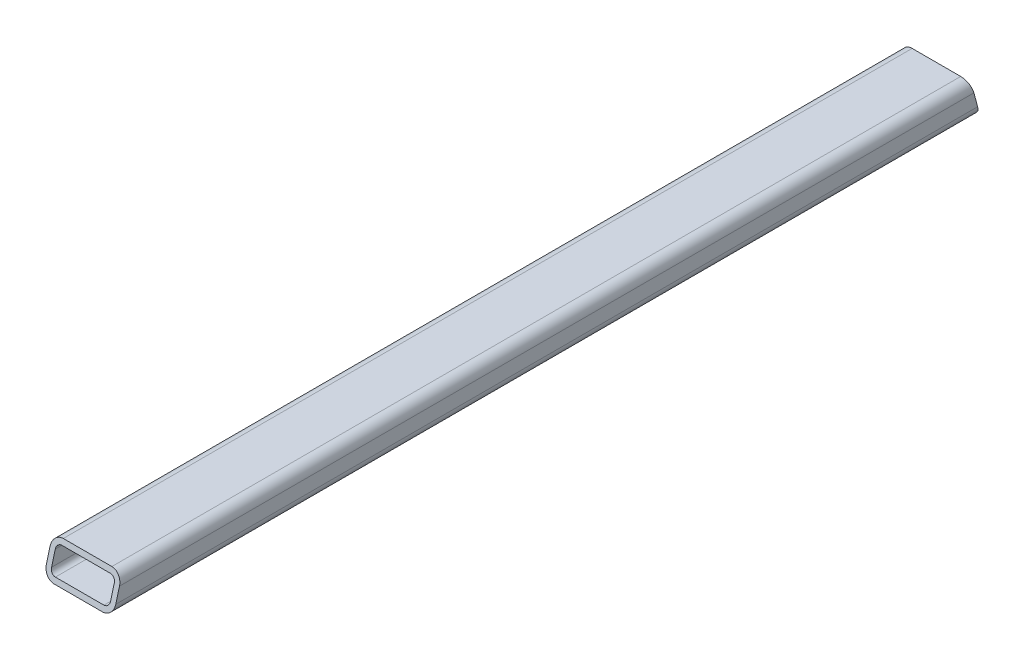
from build123d import *

# Parameters (mm, degrees)
EXTRUDE_1_DEPTH      = 250
EXTRUDE_1_DEPTH_BACK = 250
SHELL_1_T            = -3
CHAMFER_1_SIZE       = 5.358983849
CHAMFER_1_SIZE_2     = 20


with BuildPart() as part:
    # Эскиз1 → Бобышка-Вытянуть1 (new, two sides: drawn at the far end of the back side and taken through both)
    with BuildSketch(Plane.XY.offset(-EXTRUDE_1_DEPTH_BACK)):
        with BuildLine():
            Line((-14, 10), (14, 10))
            ThreePointArc((14, 10), (18.242640687, 8.242640687), (20, 4))
            Line((20, 4), (20, -4))
            ThreePointArc((20, -4), (18.242640687, -8.242640687), (14, -10))
            Line((14, -10), (-14, -10))
            ThreePointArc((-14, -10), (-18.242640687, -8.242640687), (-20, -4))
            Line((-20, -4), (-20, 4))
            ThreePointArc((-20, 4), (-18.242640687, 8.242640687), (-14, 10))
        make_face()
    extrude(amount=EXTRUDE_1_DEPTH + EXTRUDE_1_DEPTH_BACK)

    # Оболочка1
    shell_1_openings = [part.faces().sort_by_distance(p)[0] for p in [
        (0, 0, -250),
        (0, 0, 250),
    ]]
    offset(amount=SHELL_1_T, openings=shell_1_openings, kind=Kind.INTERSECTION)

    # Фаска1
    # the kernel refuses this chamfer: 20, 5.358983849 mm, written as the material it takes off along each edge
    with BuildSketch(Plane(origin=(-65.934431404, 10, -250), x_dir=(0, 0.1375124470212891, 0.9905000388259543), z_dir=(1, 0, 0))) as chamfer_1_piece_1:
        Polygon((CHAMFER_1_SIZE * 0.990500038756, CHAMFER_1_SIZE * 0.137512447012), (-CHAMFER_1_SIZE_2 * 0.137512447021, CHAMFER_1_SIZE_2 * 0.990500038826), (0, 0), align=None)
    extrude(amount=131.868862808, mode=Mode.SUBTRACT)
    with BuildSketch(Plane(origin=(-65.934431404, 10, 250), x_dir=(0, 0.1375124470212891, -0.9905000388259543), z_dir=(1, 0, 0))) as chamfer_1_piece_2:
        Polygon((CHAMFER_1_SIZE * 0.990500038756, -CHAMFER_1_SIZE * 0.137512447012), (-CHAMFER_1_SIZE_2 * 0.137512447021, -CHAMFER_1_SIZE_2 * 0.990500038826), (0, 0), align=None)
    extrude(amount=131.868862808, mode=Mode.SUBTRACT)


solid = part.part
